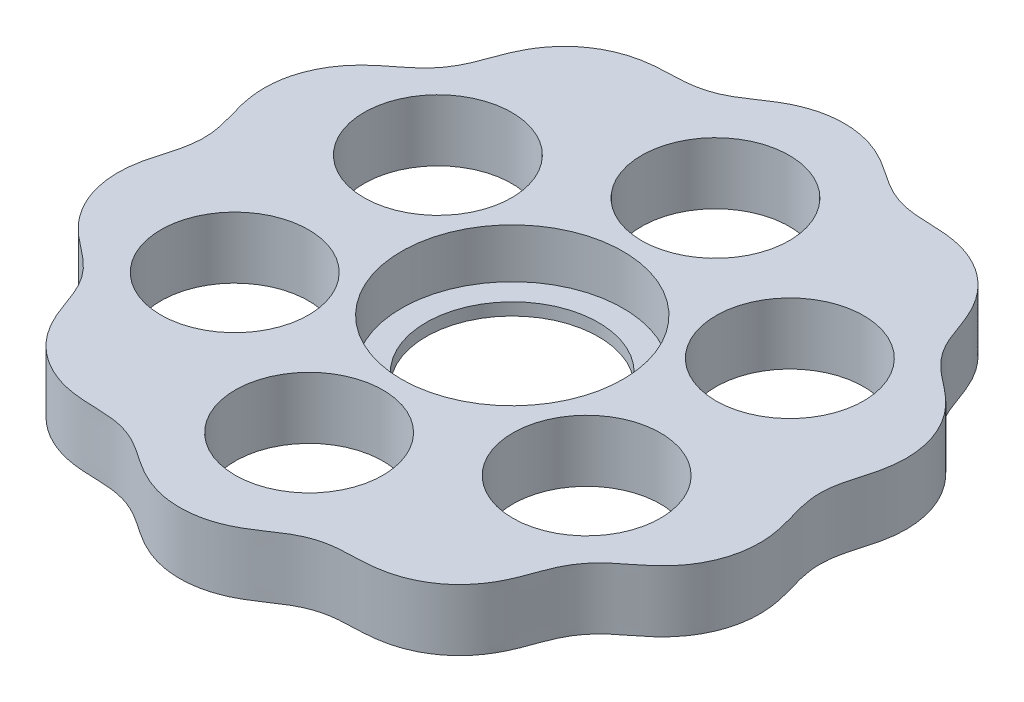
from build123d import *

# Parameters (mm, degrees)
BOSS_EXTRUDE1_DEPTH = 5
SKETCH2_R           = 9
CUT_EXTRUDE1_DEPTH  = 4
SKETCH3_R           = 7
CUT_EXTRUDE2_DEPTH  = 38.869527187
SKETCH4_R           = 6
CUT_EXTRUDE4_DEPTH  = 38.869527187


# Read off the part's stored shape, not the designer's step: Boss-Extrude1
with BuildPart() as part:
    # Boss-Extrude1 outline → Boss-Extrude1 (new body)
    with BuildSketch(Plane(origin=(0, 0, 0), x_dir=(1, 0, 0), z_dir=(0, 1, 0))):
        with BuildLine():
            Line((25.000004877, -0.010220889), (25.000004393, -0.006887556))
            add(Edge.make_bspline(
                [(25.000004393, -0.006887556), (25.00000793, 0.025178922), (25.000612212, 0.089483688), (25.003313771, 0.219310839), (25.010473335, 0.378294163), (25.023811139, 0.564866037), (25.04669905, 0.794074307), (25.083025159, 1.059066754), (25.136608535, 1.360110357), (25.200758971, 1.659131901), (25.273627435, 1.956062528), (25.357899114, 2.269329477), (25.452092793, 2.599137815), (25.579947865, 3.037579294), (25.708900568, 3.495110463), (25.823377662, 3.956656931), (25.93540103, 4.516089804), (26.027439816, 5.14435756), (26.076379782, 5.938205277), (26.022998637, 6.892461479), (25.832725117, 7.894726261), (25.511514108, 8.863042719), (25.065019379, 9.780331089), (24.529226656, 10.590138165), (23.932870151, 11.292304809), (23.304254381, 11.895818457), (22.669712763, 12.418365484), (21.950737978, 12.965965999), (21.179542096, 13.582577927), (20.39982798, 14.371854185), (19.712892387, 15.394295436), (19.199371578, 16.590885207), (18.772972271, 17.894031276), (18.154468491, 19.328756772), (17.162179498, 20.778157369), (15.739839075, 22.053751681), (14.166462825, 22.844224422), (12.758984805, 23.20829453), (11.613865473, 23.338530975), (10.756798128, 23.375664601), (9.844700015, 23.395206068), (8.876408041, 23.465438555), (7.774130681, 23.691296056), (6.587337826, 24.181905691), (5.470726346, 24.919656235), (4.328834913, 25.724581293), (2.96464242, 26.450777345), (1.346901137, 26.952612489), (-0.529285397, 27.075450322), (-2.262473008, 26.724634585), (-3.608878902, 26.135939001), (-4.613798584, 25.525852046), (-5.346575269, 25.022505603), (-6.108556893, 24.506067572), (-6.941655194, 24.03723536), (-7.996379031, 23.625330675), (-9.288118662, 23.387137081), (-10.6391706, 23.378868224), (-12.03674645, 23.315612675), (-13.524873089, 23.034452311), (-15.046306895, 22.444884913), (-16.572733253, 21.400707194), (-17.856833079, 19.893254591), (-18.698971617, 18.194567919), (-19.178231829, 16.641296823), (-19.726294326, 15.376050411), (-20.495619723, 14.251595656), (-21.453925941, 13.30442411), (-22.568900153, 12.510162359), (-23.640441066, 11.608717318), (-24.633136104, 10.489361752), (-25.461092958, 9.125684953), (-25.954565831, 7.630875883), (-26.103505391, 6.102434695), (-26.012294895, 4.869521754), (-25.839062012, 3.943952039), (-25.602654324, 3.073218321), (-25.352779327, 2.247025729), (-25.126318198, 1.373248216), (-24.986821337, 0.440454633), (-24.98669465, -0.504309026), (-25.125881873, -1.43714311), (-25.351890717, -2.311032253), (-25.601116191, -3.13742016), (-25.836634226, -4.008399493), (-26.008798591, -4.934169154), (-26.098516765, -6.167195352), (-25.94768882, -7.695448222), (-25.452367735, -9.189651137), (-24.622727616, -10.55229558), (-23.628687155, -11.670463755), (-22.556151085, -12.570683013), (-21.4405994, -13.3641695), (-20.481997666, -14.311067139), (-19.712349783, -15.435302316), (-19.163851879, -16.700325396), (-18.683207907, -18.253172317), (-17.838988954, -19.95086507), (-16.553047117, -21.456726103), (-15.02531636, -22.499019714), (-13.503166538, -23.086702821), (-12.014702041, -23.366090728), (-10.617081445, -23.427834228), (-9.26600545, -23.435284591), (-7.974178675, -23.673113185), (-6.919348147, -24.084715608), (-6.086072655, -24.553225831), (-5.32376953, -25.06917588), (-4.590530426, -25.571856921), (-3.584934987, -26.180838431), (-2.237808224, -26.767899459), (-0.504188868, -27.116572574), (1.371844176, -26.991413289), (2.988963578, -26.487587142), (4.352292835, -25.759791035), (5.493393266, -24.953764224), (6.609680279, -24.215474745), (7.796349442, -23.724542351), (8.898552498, -23.498358931), (9.866803478, -23.427673242), (10.778884548, -23.407441295), (11.635914827, -23.369451699), (12.780888444, -23.23791102), (14.18792337, -22.87211975), (15.760322921, -22.07970254), (17.181081282, -20.802349348), (18.171592431, -19.351734062), (18.788434654, -17.916313092), (19.213755917, -16.612815307), (19.726823942, -15.416003426), (20.413485826, -14.393380308), (21.192944837, -13.603861666), (21.963793026, -12.986832261), (22.682305992, -12.438620713), (23.316299642, -11.915406604), (23.94421897, -11.311164306), (24.539726528, -10.608276784), (25.074524767, -9.797811145), (25.519885197, -8.879972122), (25.839899618, -7.911258217), (26.028932522, -6.908759953), (26.081143449, -5.954437597), (26.025259169, -5.065586587), (25.907879689, -4.344612344), (25.781279508, -3.788209585), (25.659086804, -3.328808581), (25.554778041, -2.963115114), (25.45325081, -2.61602419), (25.358829488, -2.28627638), (25.274368046, -1.973064387), (25.2013457, -1.676168339), (25.137060787, -1.377175431), (25.083360104, -1.076151563), (25.046942374, -0.811169964), (25.023981423, -0.581969134), (25.010586775, -0.395412625), (25.003380078, -0.236334122), (25.000640748, -0.10671303), (25.00001773, -0.042287456), (25.000004877, -0.010220889)],
                knots=[0.08046152, 0.08046152, 0.08046152, 0.08046152, 0.08046152, 0.081216143, 0.081970766, 0.082725389, 0.083480012, 0.084989259, 0.086498505, 0.088007751, 0.089516997, 0.091026244, 0.09253549, 0.094412697, 0.096289905, 0.10004432, 0.101921527, 0.103798735, 0.107553149, 0.112574371, 0.117595593, 0.122617069, 0.127638544, 0.132659952, 0.13768136, 0.141736286, 0.145791212, 0.149846137, 0.153901063, 0.159587406, 0.165273749, 0.171662748, 0.178051746, 0.18520834, 0.192364934, 0.202407301, 0.212450102, 0.222492599, 0.226723993, 0.230955388, 0.235186783, 0.239418177, 0.244752443, 0.250086709, 0.257327181, 0.264567653, 0.271122461, 0.277677269, 0.287720114, 0.297762625, 0.307804989, 0.312191216, 0.316577443, 0.320963669, 0.325349896, 0.330375172, 0.335400449, 0.343242122, 0.351083796, 0.357036679, 0.362989561, 0.373032437, 0.383075639, 0.393117634, 0.401639944, 0.410162254, 0.415187631, 0.420213008, 0.428406087, 0.436599166, 0.442200503, 0.44780184, 0.457844221, 0.467886803, 0.472907763, 0.477928723, 0.482190508, 0.486452293, 0.490714078, 0.494975863, 0.499999795, 0.505023726, 0.509285512, 0.513547297, 0.517809083, 0.522070868, 0.527091822, 0.532112775, 0.542155364, 0.552197737, 0.557799076, 0.563400415, 0.571593502, 0.57978659, 0.584811961, 0.589837333, 0.598359639, 0.606881945, 0.616923946, 0.626967148, 0.637010031, 0.642962908, 0.648915786, 0.656757468, 0.664599151, 0.669624415, 0.67464968, 0.67903591, 0.68342214, 0.68780837, 0.692194601, 0.702236964, 0.712279472, 0.722322312, 0.72887712, 0.735431927, 0.742672408, 0.749912889, 0.755247162, 0.760581435, 0.764812819, 0.769044203, 0.773275587, 0.777506971, 0.787549477, 0.797592286, 0.807634641, 0.814791236, 0.821947832, 0.828336838, 0.834725845, 0.840412181, 0.846098518, 0.850153444, 0.85420837, 0.858263296, 0.862318222, 0.867339631, 0.872361039, 0.877382515, 0.882403991, 0.887425216, 0.892446441, 0.896200845, 0.89995525, 0.901832453, 0.903709655, 0.905586857, 0.90746406, 0.90897331, 0.910482561, 0.911991811, 0.913501062, 0.915010313, 0.916519563, 0.917274188, 0.918028814, 0.918783439, 0.919538064, 0.919538064, 0.919538064, 0.919538064, 0.919538064], degree=4))
        make_face()
    extrude(amount=BOSS_EXTRUDE1_DEPTH)

    # Sketch2 → Cut-Extrude1 (cut)
    with BuildSketch(Plane(origin=(0, 5, 0), x_dir=(1, 0, 0), z_dir=(0, 1, 0))):
        with Locations(Location((0, 0, 0), (0, 0, 270))):
            Circle(SKETCH2_R)
    extrude(amount=-CUT_EXTRUDE1_DEPTH, mode=Mode.SUBTRACT)

    # Sketch3 → Cut-Extrude2 (cut, through all)
    with BuildSketch(Plane(origin=(0, 5, 0), x_dir=(1, 0, 0), z_dir=(0, 1, 0))):
        with Locations(Location((0, 0, 0), (0, 0, 270))):
            Circle(SKETCH3_R)
    extrude(amount=-CUT_EXTRUDE2_DEPTH, mode=Mode.SUBTRACT)

    # Sketch4 → Cut-Extrude4 (cut, through all)
    with BuildSketch(Plane(origin=(0, 5, 0), x_dir=(1, 0, 0), z_dir=(0, 1, 0))):
        with Locations(Location((0, 16.5, 0), (0, 0, 270))):
            Circle(SKETCH4_R)
        with Locations(Location((14.289419162, 8.25, 0), (0, 0, 270))):
            Circle(SKETCH4_R)
        with Locations(Location((14.289419162, -8.25, 0), (0, 0, 270))):
            Circle(SKETCH4_R)
        with Locations(Location((0, -16.5, 0), (0, 0, 270))):
            Circle(SKETCH4_R)
        with Locations(Location((-14.289419162, -8.25, 0), (0, 0, 270))):
            Circle(SKETCH4_R)
        with Locations(Location((-14.289419162, 8.25, 0), (0, 0, 270))):
            Circle(SKETCH4_R)
    extrude(amount=-CUT_EXTRUDE4_DEPTH, mode=Mode.SUBTRACT)


solid = part.part
